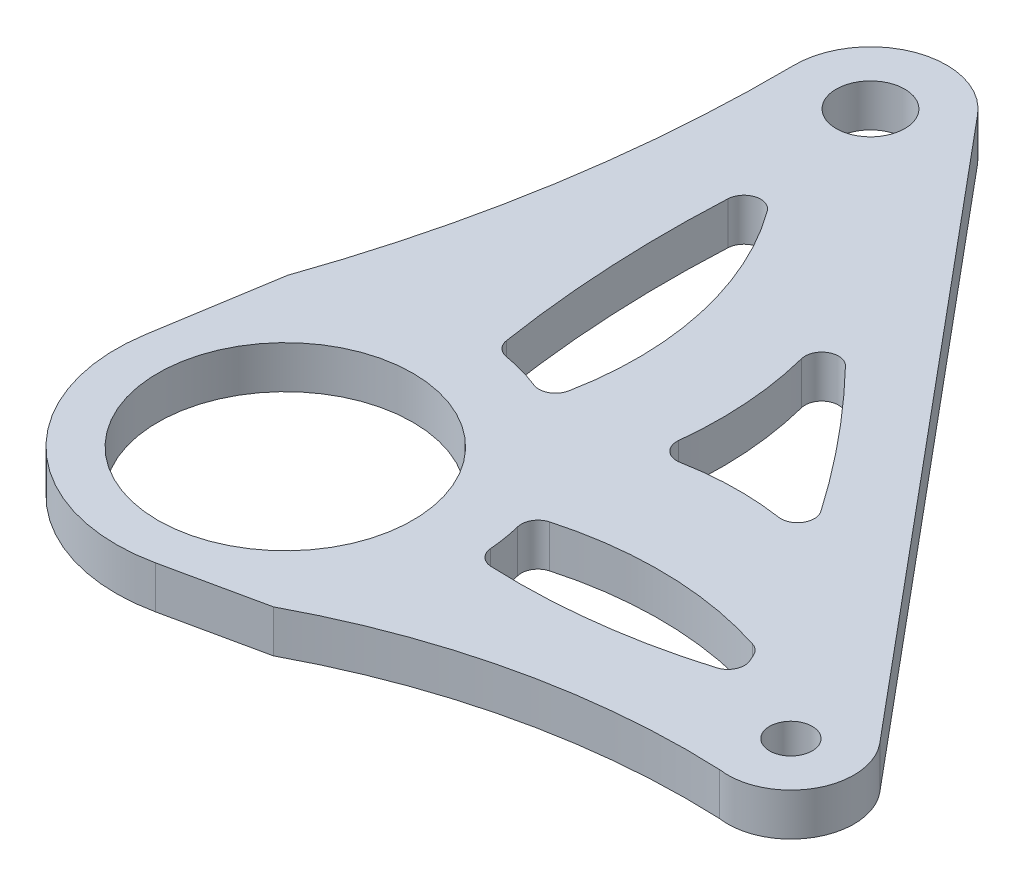
from build123d import *

# Parameters (mm, degrees)
SKETCH1_R           = 4.1
SKETCH1_R_2         = 15.25
SKETCH1_R_3         = 2.55
BOSS_EXTRUDE1_DEPTH = 5.08
CUT_EXTRUDE1_DEPTH  = 105.454283301
FILLET1_R           = 2


with BuildPart() as part:
    # Sketch1 → Boss-Extrude1 (new body)
    with BuildSketch(Plane(origin=(0, 0, 0), x_dir=(1, 0, 0), z_dir=(0, 1, 0))):
        with BuildLine():
            ThreePointArc((6.984566981, 75.833165872), (-2.409020707, 78.775341545), (-8.98381599, 71.4495))
            Line((-8.98381599, 71.4495), (-19.99145866, 3.225535714))
            ThreePointArc((-19.99145866, 3.225535714), (-13.944801539, -14.683494476), (4.252232143, -19.798510596))
            Line((4.252232143, -19.798510596), (62.065400132, -7.381666913))
            ThreePointArc((62.065400132, -7.381666913), (67.618419493, -2.458753168), (66.27488799, 4.839604652))
            Line((66.27488799, 4.839604652), (6.984566981, 75.833165872))
        make_face()
        with Locations((0, 70)):
            Circle(SKETCH1_R, mode=Mode.SUBTRACT)
        Circle(SKETCH1_R_2, mode=Mode.SUBTRACT)
        with Locations((60.48, 0)):
            Circle(SKETCH1_R_3, mode=Mode.SUBTRACT)
    extrude(amount=BOSS_EXTRUDE1_DEPTH)

    # Sketch3 → Cut-Extrude1 (cut, through all)
    with BuildSketch(Plane(origin=(0, 5.08, 0), x_dir=(1, 0, 0), z_dir=(0, 1, 0))):
        with BuildLine():
            ThreePointArc((-9.097712505, 69.79597263), (-9.078488662, 70.625334808), (-8.98381599, 71.4495))
            Line((-8.98381599, 71.4495), (-17.626250656, 17.884793035))
            ThreePointArc((-17.626250656, 17.884793035), (-11.106258281, 43.469787859), (-9.097712505, 69.79597263))
        make_face()
        with BuildLine():
            Line((15.871964591, -17.302878433), (62.065400132, -7.381666913))
            ThreePointArc((62.065400132, -7.381666913), (60.739608828, -7.545535319), (59.405689958, -7.473175893))
            ThreePointArc((59.405689958, -7.473175893), (36.980152733, -9.470893457), (15.871964591, -17.302878433))
        make_face()
        with BuildLine():
            ThreePointArc((22.88948234, 0), (37.057647693, 0.408874548), (50.871348174, 3.58468419))
            ThreePointArc((50.871348174, 3.58468419), (50.053888165, 5.412906524), (49.208244555, 7.228264521))
            ThreePointArc((49.208244555, 7.228264521), (35.446041799, 9.598832074), (21.651104057, 7.426849597))
            ThreePointArc((21.651104057, 7.426849597), (22.577765232, 3.764693736), (22.88948234, 0))
        make_face()
        with BuildLine():
            ThreePointArc((10.605441594, 20.284304533), (10.671594777, 39.957881353), (1.142153742, 57.169614406))
            ThreePointArc((1.142153742, 57.169614406), (0.710888957, 39.920017846), (2.474210049, 22.755366102))
            ThreePointArc((2.474210049, 22.755366102), (6.655513361, 21.90051469), (10.605441594, 20.284304533))
        make_face()
        with BuildLine():
            ThreePointArc((41.506207516, 21.154850749), (31.133994274, 35.251896418), (18.955088084, 47.821055027))
            ThreePointArc((18.955088084, 47.821055027), (22.751990116, 34.85714559), (22.486609256, 21.351258506))
            ThreePointArc((22.486609256, 21.351258506), (32.01018451, 22.587097355), (41.506207516, 21.154850749))
        make_face()
    extrude(amount=-CUT_EXTRUDE1_DEPTH, mode=Mode.SUBTRACT)

    # Fillet1
    fillet1_edges = [part.edges().sort_by_distance(p)[0] for p in [
        (50.871348174, 2.54, -3.58468419),
        (22.88948234, 2.54, 0),
        (21.651104057, 2.54, -7.426849597),
        (49.208244555, 2.54, -7.228264521),
        (41.506207516, 2.54, -21.154850749),
        (18.955088084, 2.54, -47.821055027),
        (22.486609256, 2.54, -21.351258506),
        (10.605441594, 2.54, -20.284304533),
        (2.474210049, 2.54, -22.755366102),
        (1.142153742, 2.54, -57.169614406),
    ]]
    fillet(fillet1_edges, radius=FILLET1_R)


solid = part.part
